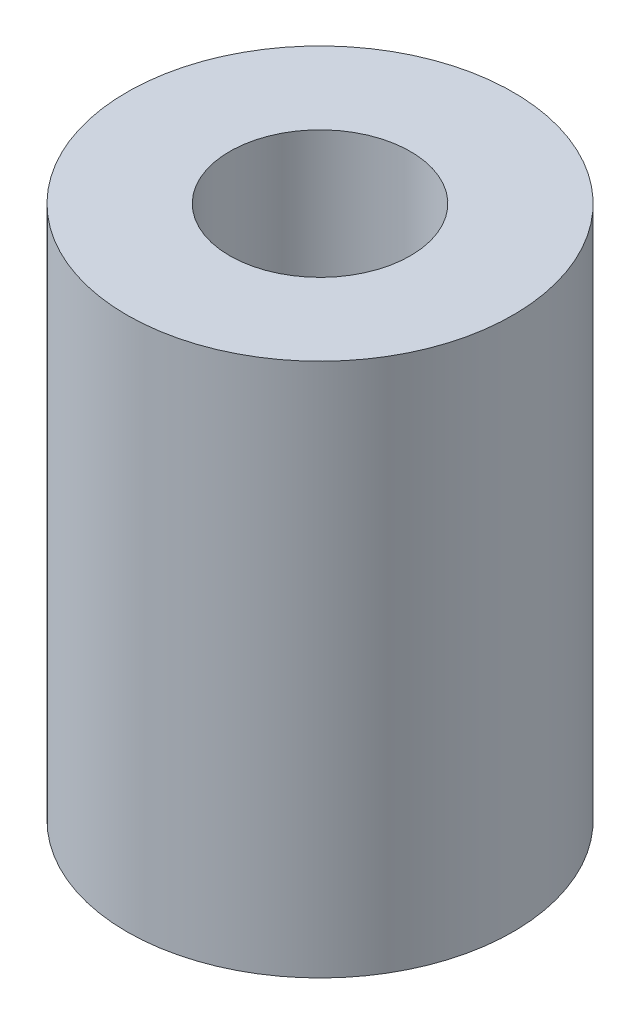
from build123d import *

# Parameters (mm, degrees)
SKETCH1_R           = 5.969
SKETCH1_R_2         = 2.794
BOSS_EXTRUDE1_DEPTH = 16.51


with BuildPart() as part:
    # Sketch1 → Boss-Extrude1 (new body)
    with BuildSketch(Plane(origin=(0, 0, 0), x_dir=(1, 0, 0), z_dir=(0, 1, 0))):
        Circle(SKETCH1_R)
        Circle(SKETCH1_R_2, mode=Mode.SUBTRACT)
    extrude(amount=BOSS_EXTRUDE1_DEPTH)


solid = part.part
